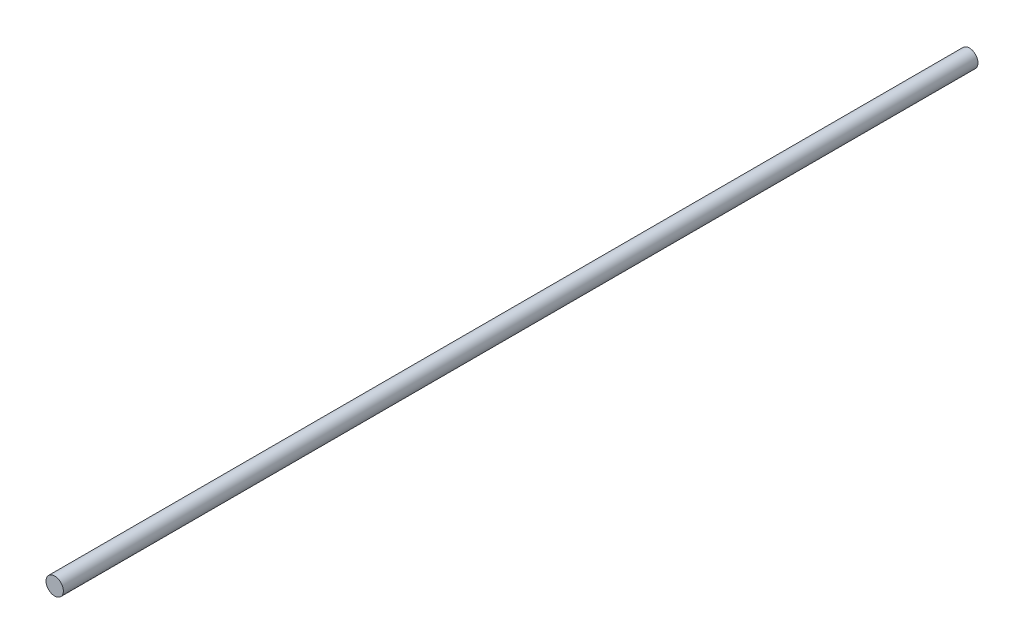
from build123d import *

# Parameters (mm, degrees)
SKETCH2_W = 421.400000948
SKETCH2_H = 4


with BuildPart() as part:
    # Sketch2 → Revolve1 (revolve)
    with BuildSketch(Plane(origin=(0, 0, 0), x_dir=(0, 0, -1), z_dir=(1, 0, 0))):
        with Locations((191.6, 2)):
            Rectangle(SKETCH2_W, SKETCH2_H)
    revolve(axis=Axis((0, 0, 19.100000474), (0, 0, -1)))


solid = part.part
